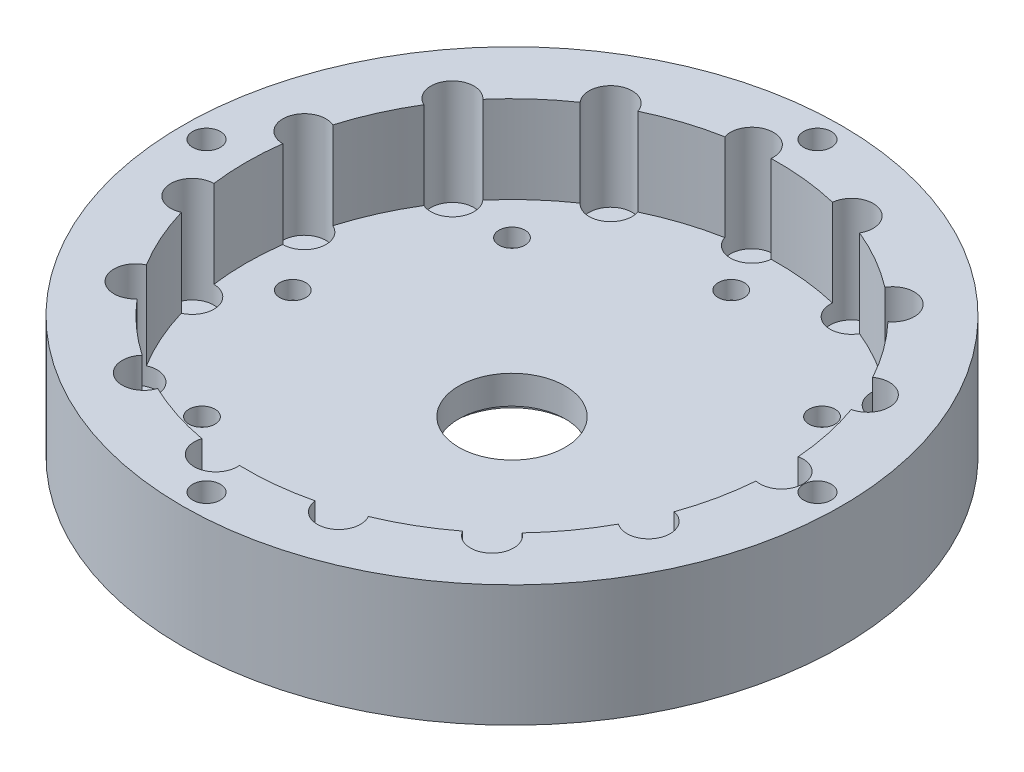
from build123d import *

# Parameters (mm, degrees)
SKETCH1_R           = 45.85
SKETCH1_R_2         = 1.5635
SKETCH1_R_3         = 7.4
BOSS_EXTRUDE1_DEPTH = 4.7625
SKETCH1_6_R         = 3
SKETCH1_6_R_2       = 1.8125
CUT_EXTRUDE1_DEPTH  = 2.5
BOSS_EXTRUDE2_START = 12.15
SKETCH1_7_R         = 45.85
SKETCH1_7_R_2       = 1.5635
BOSS_EXTRUDE2_DEPTH = 12.15
SKETCH2_R           = 1.925
CUT_EXTRUDE2_DEPTH  = 4
CUT_EXTRUDE3_START  = -3.9625
SKETCH1_8_R         = 8.25
SKETCH1_8_R_2       = 7.4
CUT_EXTRUDE3_DEPTH  = 0.8


with BuildPart() as part:
    # Sketch1 → Boss-Extrude1 (new body)
    with BuildSketch(Plane(origin=(0, 0, 0), x_dir=(1, 0, 0), z_dir=(0, 1, 0))):
        Circle(SKETCH1_R)
        with Locations((0, -42.5)):
            Circle(SKETCH1_R_2, mode=Mode.SUBTRACT)
        with Locations((-42.5, 0)):
            Circle(SKETCH1_R_2, mode=Mode.SUBTRACT)
        with Locations((42.5, 0)):
            Circle(SKETCH1_R_2, mode=Mode.SUBTRACT)
        with Locations((0, 42.5)):
            Circle(SKETCH1_R_2, mode=Mode.SUBTRACT)
        Circle(SKETCH1_R_3, mode=Mode.SUBTRACT)
    extrude(amount=-BOSS_EXTRUDE1_DEPTH)

    # Sketch1<6> → Cut-Extrude1 (cut)
    with BuildSketch(Plane(origin=(0, 0, 0), x_dir=(1, 0, 0), z_dir=(0, 1, 0))):
        with Locations((37.5, 0)):
            Circle(SKETCH1_6_R)
        with Locations((34.257954662, 15.252624115)):
            Circle(SKETCH1_6_R)
        with Locations((34.257954662, -15.252624115)):
            Circle(SKETCH1_6_R)
        with Locations((25.092397738, 27.867930955)):
            Circle(SKETCH1_6_R)
        with Locations((25.092397738, -27.867930955)):
            Circle(SKETCH1_6_R)
        with Locations((11.588137289, 35.664619361)):
            Circle(SKETCH1_6_R)
        with Locations((11.588137289, -35.664619361)):
            Circle(SKETCH1_6_R)
        with Locations((-3.919817373, 37.294571076)):
            Circle(SKETCH1_6_R)
        with Locations((-3.919817373, -37.294571076)):
            Circle(SKETCH1_6_R)
        with Locations((-18.75, 32.475952642)):
            Circle(SKETCH1_6_R)
        with Locations((-18.75, -32.475952642)):
            Circle(SKETCH1_6_R)
        with Locations((-30.338137289, 22.041946961)):
            Circle(SKETCH1_6_R)
        with Locations((-30.338137289, -22.041946961)):
            Circle(SKETCH1_6_R)
        with Locations((-36.680535028, 7.796688406)):
            Circle(SKETCH1_6_R)
        with Locations((-36.680535028, -7.796688406)):
            Circle(SKETCH1_6_R)
        with Locations((30.5, 0)):
            Circle(SKETCH1_6_R_2)
        with Locations((21.566756826, -21.566756826)):
            Circle(SKETCH1_6_R_2)
        with Locations((0, -30.5)):
            Circle(SKETCH1_6_R_2)
        with Locations((-21.566756826, -21.566756826)):
            Circle(SKETCH1_6_R_2)
        with Locations((-30.5, 0)):
            Circle(SKETCH1_6_R_2)
        with Locations((-21.566756826, 21.566756826)):
            Circle(SKETCH1_6_R_2)
        with Locations((0, 30.5)):
            Circle(SKETCH1_6_R_2)
        with Locations((21.566756826, 21.566756826)):
            Circle(SKETCH1_6_R_2)
    extrude(amount=-CUT_EXTRUDE1_DEPTH, mode=Mode.SUBTRACT)

    # Sketch1<7> → Boss-Extrude2 (add)
    with BuildSketch(Plane(origin=(0, 0, 0), x_dir=(1, 0, 0), z_dir=(0, 1, 0)).offset(BOSS_EXTRUDE2_START)):
        Circle(SKETCH1_7_R)
        with Locations((0, -42.5)):
            Circle(SKETCH1_7_R_2, mode=Mode.SUBTRACT)
        with Locations((-42.5, 0)):
            Circle(SKETCH1_7_R_2, mode=Mode.SUBTRACT)
        with Locations((42.5, 0)):
            Circle(SKETCH1_7_R_2, mode=Mode.SUBTRACT)
        with BuildLine():
            ThreePointArc((36.883333333, 2.935936345), (39.39076704, 2.32916294), (40.5, 0))
            ThreePointArc((40.5, 0), (39.39076704, -2.32916294), (36.883333333, -2.935936345))
            ThreePointArc((36.883333333, -2.935936345), (36.191461227, -7.69273256), (34.888754523, -12.319691873))
            ThreePointArc((34.888754523, -12.319691873), (36.59166411, -13.367471546), (37.257954662, -15.252624115))
            ThreePointArc((37.257954662, -15.252624115), (35.6231437, -17.924001829), (32.500448736, -17.683914497))
            ThreePointArc((32.500448736, -17.683914497), (29.933628792, -21.748054335), (26.861593101, -25.445133446))
            ThreePointArc((26.861593101, -25.445133446), (27.767055295, -26.50917897), (28.092397738, -27.867930955))
            ThreePointArc((28.092397738, -27.867930955), (25.872343464, -30.764771418), (22.497941295, -29.37418318))
            ThreePointArc((22.497941295, -29.37418318), (18.5, -32.04293994), (14.189818202, -34.170880284))
            ThreePointArc((14.189818202, -34.170880284), (14.486847583, -34.891651942), (14.588137289, -35.664619361))
            ThreePointArc((14.588137289, -35.664619361), (11.748752331, -38.660316744), (8.605335417, -35.985388734))
            ThreePointArc((8.605335417, -35.985388734), (3.867553141, -36.797310129), (-0.935505175, -36.988171489))
            ThreePointArc((-0.935505175, -36.988171489), (-0.92374189, -37.141170608), (-0.919817373, -37.294571076))
            ThreePointArc((-0.919817373, -37.294571076), (-4.385552663, -40.258199029), (-6.775211132, -36.37439366))
            ThreePointArc((-6.775211132, -36.37439366), (-11.433628792, -35.189091103), (-15.899071208, -33.409871815))
            ThreePointArc((-15.899071208, -33.409871815), (-20.25, -35.074028853), (-20.984262125, -30.47393547))
            ThreePointArc((-20.984262125, -30.47393547), (-24.757832435, -27.496358543), (-28.113543391, -24.054701786))
            ThreePointArc((-28.113543391, -24.054701786), (-32.765188272, -23.805302718), (-31.564943561, -19.304256991))
            ThreePointArc((-31.564943561, -19.304256991), (-33.801181933, -15.049255794), (-35.466928517, -10.540255288))
            ThreePointArc((-35.466928517, -10.540255288), (-39.61497783, -8.420423478), (-36.687759497, -4.796697105))
            ThreePointArc((-36.687759497, -4.796697105), (-37, 0), (-36.687759497, 4.796697105))
            ThreePointArc((-36.687759497, 4.796697105), (-39.61497783, 8.420423478), (-35.466928517, 10.540255288))
            ThreePointArc((-35.466928517, 10.540255288), (-33.801181933, 15.049255794), (-31.564943561, 19.304256991))
            ThreePointArc((-31.564943561, 19.304256991), (-32.765188272, 23.805302718), (-28.113543391, 24.054701786))
            ThreePointArc((-28.113543391, 24.054701786), (-24.757832435, 27.496358543), (-20.984262125, 30.47393547))
            ThreePointArc((-20.984262125, 30.47393547), (-20.25, 35.074028853), (-15.899071208, 33.409871815))
            ThreePointArc((-15.899071208, 33.409871815), (-11.433628792, 35.189091103), (-6.775211132, 36.37439366))
            ThreePointArc((-6.775211132, 36.37439366), (-4.385552663, 40.258199029), (-0.919817373, 37.294571076))
            ThreePointArc((-0.919817373, 37.294571076), (-0.92374189, 37.141170608), (-0.935505175, 36.988171489))
            ThreePointArc((-0.935505175, 36.988171489), (3.867553141, 36.797310129), (8.605335417, 35.985388734))
            ThreePointArc((8.605335417, 35.985388734), (11.748752331, 38.660316744), (14.588137289, 35.664619361))
            ThreePointArc((14.588137289, 35.664619361), (14.486847583, 34.891651942), (14.189818202, 34.170880284))
            ThreePointArc((14.189818202, 34.170880284), (18.5, 32.04293994), (22.497941295, 29.37418318))
            ThreePointArc((22.497941295, 29.37418318), (25.872343464, 30.764771418), (28.092397738, 27.867930955))
            ThreePointArc((28.092397738, 27.867930955), (27.767055295, 26.50917897), (26.861593101, 25.445133446))
            ThreePointArc((26.861593101, 25.445133446), (29.933628792, 21.748054335), (32.500448736, 17.683914497))
            ThreePointArc((32.500448736, 17.683914497), (35.6231437, 17.924001829), (37.257954662, 15.252624115))
            ThreePointArc((37.257954662, 15.252624115), (36.59166411, 13.367471546), (34.888754523, 12.319691873))
            ThreePointArc((34.888754523, 12.319691873), (36.191461227, 7.69273256), (36.883333333, 2.935936345))
        make_face(mode=Mode.SUBTRACT)
        with Locations((0, 42.5)):
            Circle(SKETCH1_7_R_2, mode=Mode.SUBTRACT)
    extrude(amount=-BOSS_EXTRUDE2_DEPTH)

    # Sketch2 → Cut-Extrude2 (cut)
    with BuildSketch(Plane(origin=(0, 12.15, 0), x_dir=(1, 0, 0), z_dir=(0, 1, 0))):
        with Locations((-42.5, 0)):
            Circle(SKETCH2_R)
        with Locations((0, 42.5)):
            Circle(SKETCH2_R)
        with Locations((42.5, 0)):
            Circle(SKETCH2_R)
        with Locations((0, -42.5)):
            Circle(SKETCH2_R)
    extrude(amount=-CUT_EXTRUDE2_DEPTH, mode=Mode.SUBTRACT)

    # Sketch1<8> → Cut-Extrude3 (cut)
    with BuildSketch(Plane(origin=(0, 0, 0), x_dir=(1, 0, 0), z_dir=(0, 1, 0)).offset(CUT_EXTRUDE3_START)):
        Circle(SKETCH1_8_R)
        Circle(SKETCH1_8_R_2, mode=Mode.SUBTRACT)
    extrude(amount=-CUT_EXTRUDE3_DEPTH, mode=Mode.SUBTRACT)


solid = part.part
